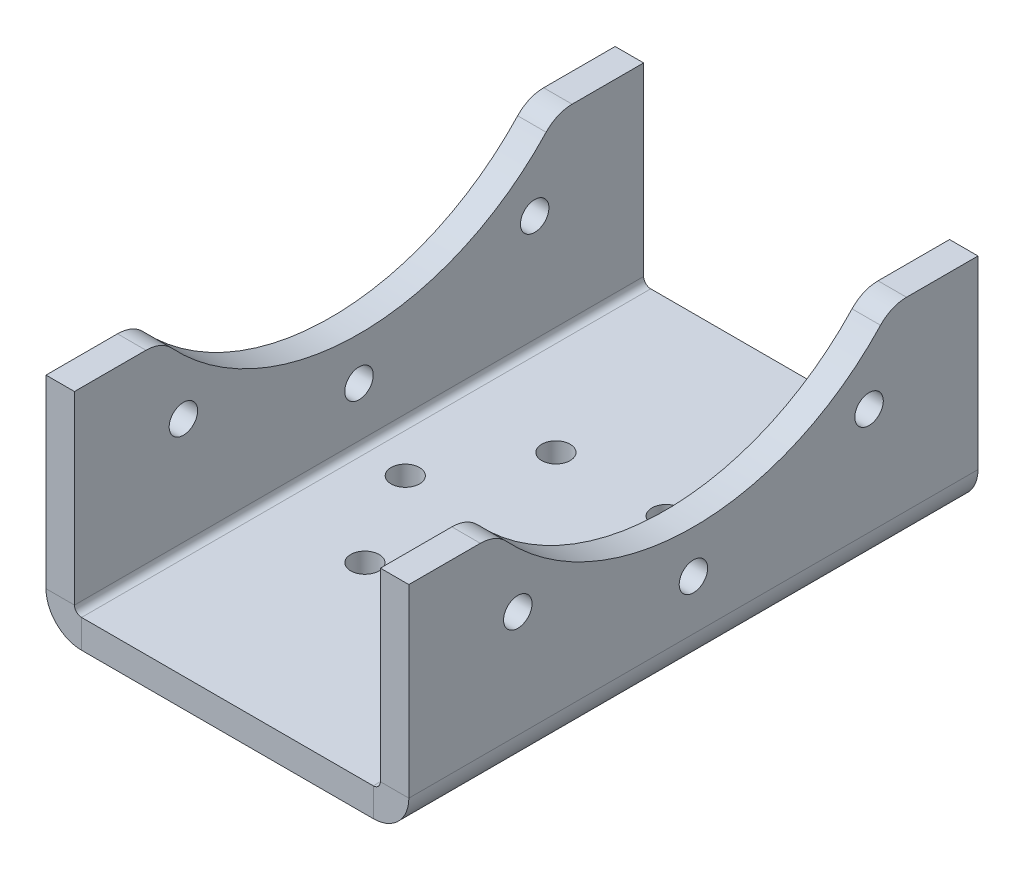
from build123d import *

# Parameters (mm, degrees)
SM_BASE_FLANGE_1_DEPTH   = 80
CUT_EXTRUDE_3_DEPTH      = 99.640762365
CUT_EXTRUDE_3_DEPTH_BACK = 99.640762365
SKETCH_6_R               = 36
SKETCH_6_R_2             = 2
FILLET_1_R               = 5
SKETCH_9_R               = 2
CUT_EXTRUDE_4_DEPTH      = 90.505586418


# Sheet-metal steps are written as plain solids
with BuildPart() as part:
    # Sketch 1 → Базовая кромка1 (new body)
    with BuildSketch(Plane.XY):
        with BuildLine():
            Line((-21.5, 27), (-21.5, 1))
            ThreePointArc((-21.5, 1), (-21.207106781, 0.292893219), (-20.5, 0))
            Line((-20.5, 0), (20.5, 0))
            ThreePointArc((20.5, 0), (21.207106781, 0.292893219), (21.5, 1))
            Line((21.5, 1), (21.5, 27))
            Line((21.5, 27), (25.5, 27))
            Line((25.5, 27), (25.5, 1))
            ThreePointArc((25.5, 1), (24.035533906, -2.535533906), (20.5, -4))
            Line((20.5, -4), (-20.5, -4))
            ThreePointArc((-20.5, -4), (-24.035533906, -2.535533906), (-25.5, 1))
            Line((-25.5, 1), (-25.5, 27))
            Line((-25.5, 27), (-21.5, 27))
        make_face()
    extrude(amount=SM_BASE_FLANGE_1_DEPTH)

    # Эскиз6 → Вырез-Вытянуть3 (cut, two sides: drawn at the far end of the back side and taken through both)
    with BuildSketch(Plane.ZY.offset(25.5).offset(-CUT_EXTRUDE_3_DEPTH_BACK)):
        with Locations((40, 50)):
            Circle(SKETCH_6_R)
        with Locations((40, 8)):
            Circle(SKETCH_6_R_2)
        with Locations((15.313019404, 16.021286236)):
            Circle(SKETCH_6_R_2)
        with Locations((64.686980596, 16.021286236)):
            Circle(SKETCH_6_R_2)
    extrude(amount=CUT_EXTRUDE_3_DEPTH + CUT_EXTRUDE_3_DEPTH_BACK, mode=Mode.SUBTRACT)

    # Скругление1
    fillet_1_edges = [part.edges().sort_by_distance(p)[0] for p in [
        (23.5, 27, 12.305235152),
        (23.5, 27, 67.694764848),
        (-23.5, 27, 12.305235152),
        (-23.5, 27, 67.694764848),
    ]]
    fillet(fillet_1_edges, radius=FILLET_1_R)

    # Эскиз9 → Вырез-Вытянуть4 (cut, through all)
    with BuildSketch(Plane.XZ.offset(4)):
        with Locations((16, 40)):
            Circle(SKETCH_9_R)
        with Locations((8.25, 26.576606241)):
            Circle(SKETCH_9_R)
        with Locations((-7.25, 26.576606241)):
            Circle(SKETCH_9_R)
        with Locations((-15, 40)):
            Circle(SKETCH_9_R)
        with Locations((-7.25, 53.423393759)):
            Circle(SKETCH_9_R)
        with Locations((8.25, 53.423393759)):
            Circle(SKETCH_9_R)
    extrude(amount=-CUT_EXTRUDE_4_DEPTH, mode=Mode.SUBTRACT)


solid = part.part
